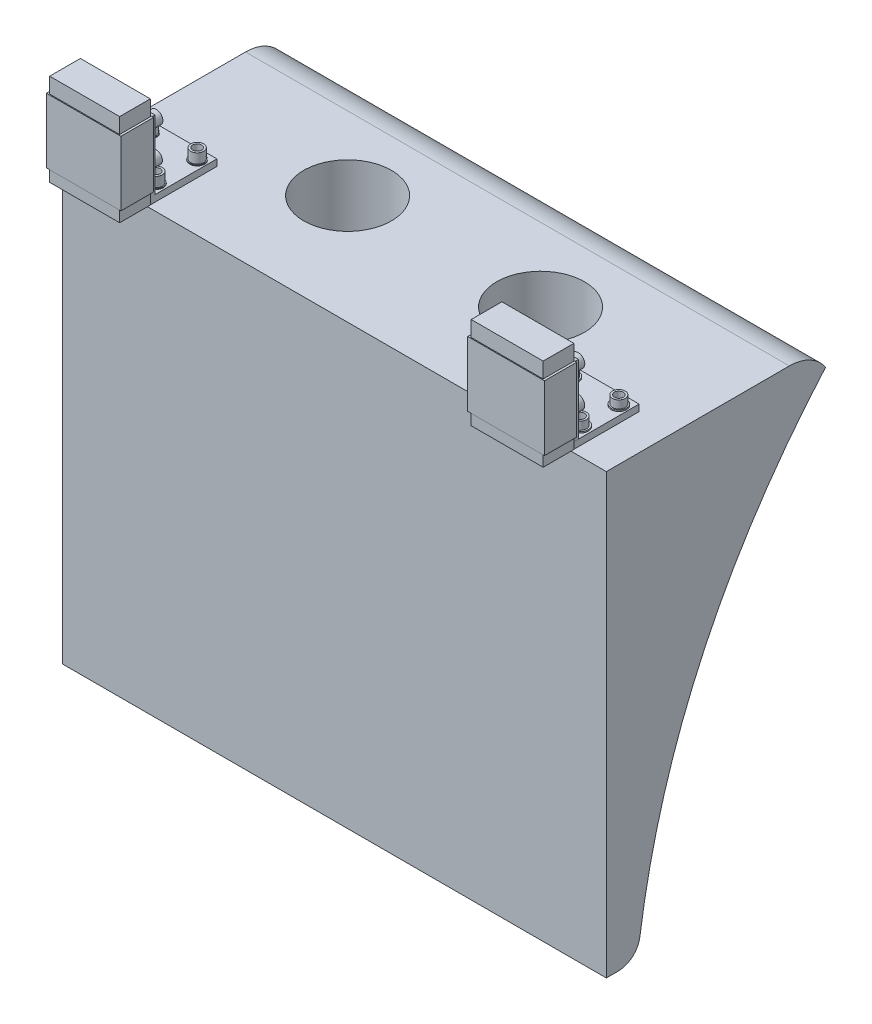
from build123d import *

# Parameters (mm, degrees)
BOSS_EXTRUDE1_DEPTH       = 242
BOSS_EXTRUDE1_DEPTH_BACK  = 6
FILLET1_R                 = 10
SKETCH2_R                 = 20
CUT_EXTRUDE2_DEPTH        = 30
SKETCH4_R                 = 20
CUT_EXTRUDE3_DEPTH        = 30
FILLET2_R                 = 20
SKETCH5_W                 = 29.954183709
SKETCH5_H                 = 31.050396145
SKETCH5_W_2               = 29.504785989
SKETCH5_H_2               = 31.799392345
BOSS_EXTRUDE2_DEPTH       = 3
SKETCH6_R                 = 3.521436552
BOSS_EXTRUDE3_DEPTH       = 0.6
SKETCH6_R_2               = 3.531766091
BOSS_EXTRUDE3_2_DEPTH     = 0.6
SKETCH6_R_3               = 3.486052036
BOSS_EXTRUDE3_3_DEPTH     = 0.6
SKETCH6_R_4               = 3.716621525
BOSS_EXTRUDE3_4_DEPTH     = 0.6
SKETCH7_R                 = 2.790281645
SKETCH7_R_2               = 1.890281645
BOSS_EXTRUDE4_DEPTH       = 3.6
SKETCH7_R_3               = 2.889128226
SKETCH7_R_4               = 1.989128226
BOSS_EXTRUDE4_2_DEPTH     = 3.6
SKETCH7_R_5               = 2.945503927
SKETCH7_R_6               = 2.045503927
BOSS_EXTRUDE4_3_DEPTH     = 3.6
SKETCH7_R_7               = 2.923587103
SKETCH7_R_8               = 2.023587103
BOSS_EXTRUDE4_4_DEPTH     = 3.6
SKETCH8_R                 = 3.59029189
SKETCH8_R_2               = 3.314555301
SKETCH8_R_3               = 3.368386703
SKETCH8_R_4               = 3.32122779
BOSS_EXTRUDE5_DEPTH       = 0.4
SKETCH9_R                 = 2.956199338
SKETCH9_R_2               = 2.056199338
SKETCH9_R_3               = 2.952787882
SKETCH9_R_4               = 2.052787882
SKETCH9_R_5               = 3.175096382
SKETCH9_R_6               = 2.275096382
SKETCH9_R_7               = 2.891369585
SKETCH9_R_8               = 1.991369585
BOSS_EXTRUDE6_DEPTH       = 4.5
SKETCH11_W                = 29.954183709
SKETCH11_H                = 3.34185216
SKETCH11_W_2              = 29.504785989
SKETCH11_H_2              = 3.531318097
BOSS_EXTRUDE7_DEPTH       = 31.5
SKETCH12_R                = 3.571562578
BOSS_EXTRUDE8_DEPTH       = 0.4
SKETCH12_R_2              = 3.629984801
BOSS_EXTRUDE8_2_DEPTH     = 0.4
SKETCH12_R_3              = 3.53819152
BOSS_EXTRUDE8_3_DEPTH     = 0.4
SKETCH12_R_4              = 3.512817256
BOSS_EXTRUDE8_4_DEPTH     = 0.4
SKETCH13_R                = 3.355416669
SKETCH13_R_2              = 3.199421294
SKETCH13_R_3              = 3.134417478
SKETCH13_R_4              = 3.44389963
BOSS_EXTRUDE9_DEPTH       = 0.4
SKETCH14_R                = 2.998694853
SKETCH14_R_2              = 2.098694853
SKETCH14_R_3              = 3.184081287
SKETCH14_R_4              = 2.284081287
SKETCH14_R_5              = 2.986646584
SKETCH14_R_6              = 2.086646584
SKETCH14_R_7              = 3.084380213
SKETCH14_R_8              = 2.184380213
SKETCH14_R_9              = 2.972177383
SKETCH14_R_10             = 2.072177383
SKETCH14_R_11             = 2.994935062
SKETCH14_R_12             = 2.094935062
SKETCH14_R_13             = 2.747519337
SKETCH14_R_14             = 1.847519337
SKETCH14_R_15             = 2.743044962
SKETCH14_R_16             = 1.843044962
BOSS_EXTRUDE10_DEPTH      = 4.5
SKETCH15_W                = 32.822125217
SKETCH15_H                = 41.949232347
SKETCH15_W_2              = 31.89694792
BOSS_EXTRUDE11_DEPTH      = 14
BOSS_EXTRUDE12_DEPTH      = 1
BOSS_EXTRUDE12_DEPTH_BACK = 33
SKETCH17_W                = 14.918298548
SKETCH17_H                = 29.467593244
BOSS_EXTRUDE13_DEPTH      = 1
BOSS_EXTRUDE13_DEPTH_BACK = 34
SKETCH18_W                = 14.661208256
SKETCH18_H                = 29.563442526


with BuildPart() as part:
    # Sketch1 → Boss-Extrude1 (new, two sides: drawn at the far end of the back side and taken through both)
    with BuildSketch(Plane(origin=(0, 0, 0), x_dir=(0, 0, -1), z_dir=(1, 0, 0)).offset(-BOSS_EXTRUDE1_DEPTH_BACK)):
        with BuildLine():
            Line((-139.187369443, 113.997653143), (-139.187369443, -86.002346857))
            Line((-139.187369443, -86.002346857), (-125.034355509, -86.002346857))
            add(Edge.make_bspline(
                [(-125.034355509, -86.002346857), (-112.066855868, 22.160578109), (-39.187369443, 105.243229852)],
                knots=[0, 0, 0, 1, 1, 1], degree=2))
            Line((-39.187369443, 105.243229852), (-39.187369443, 113.997653143))
            Line((-39.187369443, 113.997653143), (-139.187369443, 113.997653143))
        make_face()
    extrude(amount=BOSS_EXTRUDE1_DEPTH + BOSS_EXTRUDE1_DEPTH_BACK)

    # Fillet1
    fillet1_edges = [part.edges().sort_by_distance(p)[0] for p in [
        (121, -86.002346857, 125.034355509),
    ]]
    fillet(fillet1_edges, radius=FILLET1_R)

    # Sketch2 → Cut-Extrude2 (cut)
    with BuildSketch(Plane(origin=(0, 113.997653143, 0), x_dir=(1, 0, 0), z_dir=(0, 1, 0))):
        with Locations(Location((162, -89.187369443, 0), (0, 0, 270))):
            Circle(SKETCH2_R)
    extrude(amount=-CUT_EXTRUDE2_DEPTH, mode=Mode.SUBTRACT)

    # Sketch4 → Cut-Extrude3 (cut)
    with BuildSketch(Plane(origin=(0, 113.997653143, 0), x_dir=(1, 0, 0), z_dir=(0, 1, 0))):
        with Locations(Location((74, -89.187369443, 0), (0, 0, 270))):
            Circle(SKETCH4_R)
    extrude(amount=-CUT_EXTRUDE3_DEPTH, mode=Mode.SUBTRACT)

    # Fillet2
    # the kernel refuses this fillet: 20 mm, written as the material it takes off along each edge
    with BuildSketch(Plane(origin=(283.347385384, 113.997653143, 39.187369443), x_dir=(0, 0, 1), z_dir=(-1, 0, 0))) as fillet2_piece_1:
        with BuildLine():
            CenterArc((16.538954154, -20), FILLET2_R, 90, 55.786458643)
            Line((0, -8.754423292), (-0.330779083, -8.529511757))
            ThreePointArc((-0.330779083, -8.529511757), (-0.4, -4.377211646), (-0.4, 0))
            Line((-0.4, 0), (0, 0.4))
            Line((0, 0.4), (16.538954154, 0.4))
            Line((16.538954154, 0.4), (16.538954154, 0))
        make_face()
    extrude(amount=330.694770768, mode=Mode.SUBTRACT)

    # Sketch5 → Boss-Extrude2 (add)
    with BuildSketch(Plane(origin=(0, 113.997653143, 0), x_dir=(1, 0, 0), z_dir=(0, 1, 0))):
        with Locations((272.07026042, -123.560493965)):
            Rectangle(SKETCH5_W, SKETCH5_H)
        with Locations((17.934289376, -123.375461801)):
            Rectangle(SKETCH5_W_2, SKETCH5_H_2)
    extrude(amount=BOSS_EXTRUDE2_DEPTH)


with BuildPart() as boss_extrude2_piece_1:
    # of the separate pieces the step leaves, piece 1, a body of its own (boss_extrude2_pieces)
    add(part.part.solids().sort_by_distance((-6, -86.002346857, 133.804479396))[0])

    # Sketch8 → Boss-Extrude5 (add)
    with BuildSketch(Plane(origin=(0, 116.997653143, 0), x_dir=(1, 0, 0), z_dir=(0, 1, 0))):
        with Locations(Location((7.367674297, -130.775350346, 0), (0, 0, 90))):
            Circle(SKETCH8_R)
        with Locations(Location((7.104647486, -112.731711078, 0), (0, 0, 90))):
            Circle(SKETCH8_R_2)
        with Locations(Location((28.620240665, -112.416078904, 0), (0, 0, 90))):
            Circle(SKETCH8_R_3)
        with Locations(Location((28.571657152, -131.123371528, 0), (0, 0, 90))):
            Circle(SKETCH8_R_4)
    extrude(amount=BOSS_EXTRUDE5_DEPTH)

    # Sketch9 → Boss-Extrude6 (add)
    # profile 1 of 4: a face of its own
    with BuildSketch(Plane(origin=(0, 117.397653143, 0), x_dir=(1, 0, 0), z_dir=(0, 1, 0))):
        with Locations(Location((7.095441327, -112.696743219, 0), (0, 0, 270))):
            Circle(SKETCH9_R)
        with Locations(Location((7.095441327, -112.696743219, 0), (0, 0, 270))):
            Circle(SKETCH9_R_2, mode=Mode.SUBTRACT)
    # profile 2 of 4: a face of its own
    with BuildSketch(Plane(origin=(0, 117.397653143, 0), x_dir=(1, 0, 0), z_dir=(0, 1, 0))):
        with Locations(Location((28.620240665, -112.416078904, 0), (0, 0, 270))):
            Circle(SKETCH9_R_3)
        with Locations(Location((28.620240665, -112.416078904, 0), (0, 0, 270))):
            Circle(SKETCH9_R_4, mode=Mode.SUBTRACT)
    # profile 3 of 4: a face of its own
    with BuildSketch(Plane(origin=(0, 117.397653143, 0), x_dir=(1, 0, 0), z_dir=(0, 1, 0))):
        with Locations(Location((7.367674297, -130.775350346, 0), (0, 0, 270))):
            Circle(SKETCH9_R_5)
        with Locations(Location((7.367674297, -130.775350346, 0), (0, 0, 270))):
            Circle(SKETCH9_R_6, mode=Mode.SUBTRACT)
    # profile 4 of 4: a face of its own
    with BuildSketch(Plane(origin=(0, 117.397653143, 0), x_dir=(1, 0, 0), z_dir=(0, 1, 0))):
        with Locations(Location((28.571657152, -131.123371528, 0), (0, 0, 270))):
            Circle(SKETCH9_R_7)
        with Locations(Location((28.571657152, -131.123371528, 0), (0, 0, 270))):
            Circle(SKETCH9_R_8, mode=Mode.SUBTRACT)
    extrude(amount=BOSS_EXTRUDE6_DEPTH)

    # Sketch11 → Boss-Extrude7 (add)
    with BuildSketch(Plane(origin=(0, 116.997653143, 0), x_dir=(1, 0, 0), z_dir=(0, 1, 0))):
        with Locations((272.07026042, -137.414765957)):
            Rectangle(SKETCH11_W, SKETCH11_H)
        with Locations((17.934289376, -137.509498925)):
            Rectangle(SKETCH11_W_2, SKETCH11_H_2)
    extrude(amount=BOSS_EXTRUDE7_DEPTH)


with BuildPart() as boss_extrude2_piece_2:
    # of the separate pieces the step leaves, piece 2, a body of its own (boss_extrude2_pieces)
    add(part.part.solids().sort_by_distance((287.047352274, 113.997653143, 139.085692037))[0])


with BuildPart() as body_3:
    # Sketch6 → Boss-Extrude3 (new body)
    with BuildSketch(Plane(origin=(0, 116.997653143, 0), x_dir=(1, 0, 0), z_dir=(0, 1, 0))):
        with Locations(Location((261.3092488, -130.344241148, 0), (0, 0, 270))):
            Circle(SKETCH6_R)
    extrude(amount=BOSS_EXTRUDE3_DEPTH)


with BuildPart() as body_4:
    # Sketch6 → Boss-Extrude3 2 (new body)
    with BuildSketch(Plane(origin=(0, 116.997653143, 0), x_dir=(1, 0, 0), z_dir=(0, 1, 0))):
        with Locations(Location((261.004608255, -113.147316451, 0), (0, 0, 270))):
            Circle(SKETCH6_R_2)
    extrude(amount=BOSS_EXTRUDE3_2_DEPTH)


with BuildPart() as body_5:
    # Sketch6 → Boss-Extrude3 3 (new body)
    with BuildSketch(Plane(origin=(0, 116.997653143, 0), x_dir=(1, 0, 0), z_dir=(0, 1, 0))):
        with Locations(Location((282.924989398, -113.17919004, 0), (0, 0, 270))):
            Circle(SKETCH6_R_3)
    extrude(amount=BOSS_EXTRUDE3_3_DEPTH)


with BuildPart() as body_6:
    # Sketch6 → Boss-Extrude3 4 (new body)
    with BuildSketch(Plane(origin=(0, 116.997653143, 0), x_dir=(1, 0, 0), z_dir=(0, 1, 0))):
        with Locations(Location((282.476613134, -130.375500454, 0), (0, 0, 270))):
            Circle(SKETCH6_R_4)
    extrude(amount=BOSS_EXTRUDE3_4_DEPTH)


with BuildPart() as body_7:
    # Sketch7 → Boss-Extrude4 (new body)
    with BuildSketch(Plane(origin=(0, 117.597653143, 0), x_dir=(1, 0, 0), z_dir=(0, 1, 0))):
        with Locations(Location((261.3092488, -130.344241148, 0), (0, 0, 270))):
            Circle(SKETCH7_R)
        with Locations(Location((261.3092488, -130.344241148, 0), (0, 0, 270))):
            Circle(SKETCH7_R_2, mode=Mode.SUBTRACT)
    extrude(amount=BOSS_EXTRUDE4_DEPTH)


with BuildPart() as body_8:
    # Sketch7 → Boss-Extrude4 2 (new body)
    with BuildSketch(Plane(origin=(0, 117.597653143, 0), x_dir=(1, 0, 0), z_dir=(0, 1, 0))):
        with Locations(Location((261.004608255, -113.147316451, 0), (0, 0, 270))):
            Circle(SKETCH7_R_3)
        with Locations(Location((261.004608255, -113.147316451, 0), (0, 0, 270))):
            Circle(SKETCH7_R_4, mode=Mode.SUBTRACT)
    extrude(amount=BOSS_EXTRUDE4_2_DEPTH)


with BuildPart() as body_9:
    # Sketch7 → Boss-Extrude4 3 (new body)
    with BuildSketch(Plane(origin=(0, 117.597653143, 0), x_dir=(1, 0, 0), z_dir=(0, 1, 0))):
        with Locations(Location((282.476613134, -130.375500454, 0), (0, 0, 270))):
            Circle(SKETCH7_R_5)
        with Locations(Location((282.476613134, -130.375500454, 0), (0, 0, 270))):
            Circle(SKETCH7_R_6, mode=Mode.SUBTRACT)
    extrude(amount=BOSS_EXTRUDE4_3_DEPTH)


with BuildPart() as body_10:
    # Sketch7 → Boss-Extrude4 4 (new body)
    with BuildSketch(Plane(origin=(0, 117.597653143, 0), x_dir=(1, 0, 0), z_dir=(0, 1, 0))):
        with Locations(Location((282.924989398, -113.17919004, 0), (0, 0, 270))):
            Circle(SKETCH7_R_7)
        with Locations(Location((282.924989398, -113.17919004, 0), (0, 0, 270))):
            Circle(SKETCH7_R_8, mode=Mode.SUBTRACT)
    extrude(amount=BOSS_EXTRUDE4_4_DEPTH)


with BuildPart() as boss_extrude7_piece_1:
    # of the separate pieces the step leaves, piece 1, a body of its own (boss_extrude7_pieces)
    add(boss_extrude2_piece_1.part.solids().sort_by_distance((-6, -86.002346857, 133.804479396))[0])

    # Sketch13 → Boss-Extrude9 (add)
    with BuildSketch(Plane(origin=(0, 0, 135.743839877), x_dir=(-1, 0, 0), z_dir=(0, 0, -1))):
        with Locations(Location((-28.414414919, 143.13435505, 0), (0, 0, 270))):
            Circle(SKETCH13_R)
        with Locations(Location((-28.452707902, 127.335354841, 0), (0, 0, 270))):
            Circle(SKETCH13_R_2)
        with Locations(Location((-7.397497645, 127.175792958, 0), (0, 0, 270))):
            Circle(SKETCH13_R_3)
        with Locations(Location((-7.647188111, 142.931128579, 0), (0, 0, 270))):
            Circle(SKETCH13_R_4)
    extrude(amount=BOSS_EXTRUDE9_DEPTH)

    # Sketch14 → Boss-Extrude10 (add)
    # profile 1 of 8: a face of its own
    with BuildSketch(Plane(origin=(0, 0, 135.343839877), x_dir=(-1, 0, 0), z_dir=(0, 0, -1))):
        with Locations(Location((-282.078005206, 143.255450285, 0), (0, 0, 90))):
            Circle(SKETCH14_R)
        with Locations(Location((-282.078005206, 143.255450285, 0), (0, 0, 90))):
            Circle(SKETCH14_R_2, mode=Mode.SUBTRACT)
    # profile 2 of 8: a face of its own
    with BuildSketch(Plane(origin=(0, 0, 135.343839877), x_dir=(-1, 0, 0), z_dir=(0, 0, -1))):
        with Locations(Location((-261.87304946, 142.935790717, 0), (0, 0, 90))):
            Circle(SKETCH14_R_3)
        with Locations(Location((-261.87304946, 142.935790717, 0), (0, 0, 90))):
            Circle(SKETCH14_R_4, mode=Mode.SUBTRACT)
    # profile 3 of 8: a face of its own
    with BuildSketch(Plane(origin=(0, 0, 135.343839877), x_dir=(-1, 0, 0), z_dir=(0, 0, -1))):
        with Locations(Location((-261.781232047, 126.836653923, 0), (0, 0, 90))):
            Circle(SKETCH14_R_5)
        with Locations(Location((-261.781232047, 126.836653923, 0), (0, 0, 90))):
            Circle(SKETCH14_R_6, mode=Mode.SUBTRACT)
    # profile 4 of 8: a face of its own
    with BuildSketch(Plane(origin=(0, 0, 135.343839877), x_dir=(-1, 0, 0), z_dir=(0, 0, -1))):
        with Locations(Location((-281.925623501, 126.800081333, 0), (0, 0, 90))):
            Circle(SKETCH14_R_7)
        with Locations(Location((-281.925623501, 126.800081333, 0), (0, 0, 90))):
            Circle(SKETCH14_R_8, mode=Mode.SUBTRACT)
    # profile 5 of 8: a face of its own
    with BuildSketch(Plane(origin=(0, 0, 135.343839877), x_dir=(-1, 0, 0), z_dir=(0, 0, -1))):
        with Locations(Location((-28.440001176, 143.142867252, 0), (0, 0, 90))):
            Circle(SKETCH14_R_9)
        with Locations(Location((-28.440001176, 143.142867252, 0), (0, 0, 90))):
            Circle(SKETCH14_R_10, mode=Mode.SUBTRACT)
    # profile 6 of 8: a face of its own
    with BuildSketch(Plane(origin=(0, 0, 135.343839877), x_dir=(-1, 0, 0), z_dir=(0, 0, -1))):
        with Locations(Location((-7.647188111, 142.931128579, 0), (0, 0, 90))):
            Circle(SKETCH14_R_11)
        with Locations(Location((-7.647188111, 142.931128579, 0), (0, 0, 90))):
            Circle(SKETCH14_R_12, mode=Mode.SUBTRACT)
    # profile 7 of 8: a face of its own
    with BuildSketch(Plane(origin=(0, 0, 135.343839877), x_dir=(-1, 0, 0), z_dir=(0, 0, -1))):
        with Locations(Location((-28.452707902, 127.335354841, 0), (0, 0, 90))):
            Circle(SKETCH14_R_13)
        with Locations(Location((-28.452707902, 127.335354841, 0), (0, 0, 90))):
            Circle(SKETCH14_R_14, mode=Mode.SUBTRACT)
    # profile 8 of 8: a face of its own
    with BuildSketch(Plane(origin=(0, 0, 135.343839877), x_dir=(-1, 0, 0), z_dir=(0, 0, -1))):
        with Locations(Location((-7.397497645, 127.175792958, 0), (0, 0, 90))):
            Circle(SKETCH14_R_15)
        with Locations(Location((-7.397497645, 127.175792958, 0), (0, 0, 90))):
            Circle(SKETCH14_R_16, mode=Mode.SUBTRACT)
    extrude(amount=BOSS_EXTRUDE10_DEPTH)


with BuildPart() as boss_extrude7_piece_2:
    # of the separate pieces the step leaves, piece 2, a body of its own (boss_extrude7_pieces)
    add(boss_extrude2_piece_1.part.solids().sort_by_distance((287.047352274, 116.997653143, 135.743839877))[0])


with BuildPart() as body_12:
    # Sketch12 → Boss-Extrude8 (new body)
    with BuildSketch(Plane(origin=(0, 0, 135.743839877), x_dir=(-1, 0, 0), z_dir=(0, 0, -1))):
        with Locations(Location((-282.078005206, 143.255450285, 0), (0, 0, 90))):
            Circle(SKETCH12_R)
    extrude(amount=BOSS_EXTRUDE8_DEPTH)


with BuildPart() as body_13:
    # Sketch12 → Boss-Extrude8 2 (new body)
    with BuildSketch(Plane(origin=(0, 0, 135.743839877), x_dir=(-1, 0, 0), z_dir=(0, 0, -1))):
        with Locations(Location((-261.916297097, 142.918958581, 0), (0, 0, 90))):
            Circle(SKETCH12_R_2)
    extrude(amount=BOSS_EXTRUDE8_2_DEPTH)


with BuildPart() as body_14:
    # Sketch12 → Boss-Extrude8 3 (new body)
    with BuildSketch(Plane(origin=(0, 0, 135.743839877), x_dir=(-1, 0, 0), z_dir=(0, 0, -1))):
        with Locations(Location((-281.925623501, 126.800081333, 0), (0, 0, 90))):
            Circle(SKETCH12_R_3)
    extrude(amount=BOSS_EXTRUDE8_3_DEPTH)


with BuildPart() as body_15:
    # Sketch12 → Boss-Extrude8 4 (new body)
    with BuildSketch(Plane(origin=(0, 0, 135.743839877), x_dir=(-1, 0, 0), z_dir=(0, 0, -1))):
        with Locations(Location((-261.781232047, 126.836653923, 0), (0, 0, 90))):
            Circle(SKETCH12_R_4)
    extrude(amount=BOSS_EXTRUDE8_4_DEPTH)


with BuildPart() as boss_extrude10_piece_1:
    # of the separate pieces the step leaves, piece 1, a body of its own (boss_extrude10_pieces)
    add(boss_extrude7_piece_1.part.solids().sort_by_distance((-6, -86.002346857, 133.804479396))[0])

    # Sketch15 → Boss-Extrude11 (add)
    with BuildSketch(Plane.XY.offset(139.085692037)):
        with Locations((271.924973852, 136.165188854)):
            Rectangle(SKETCH15_W, SKETCH15_H)
        with Locations((17.992191051, 136.165188854)):
            Rectangle(SKETCH15_W_2, SKETCH15_H)
    extrude(amount=BOSS_EXTRUDE11_DEPTH)


with BuildPart() as boss_extrude10_piece_2:
    # of the separate pieces the step leaves, piece 2, a body of its own (boss_extrude10_pieces)
    add(boss_extrude7_piece_1.part.solids().sort_by_distance((261.87304946, 146.119872004, 135.343839877))[0])


with BuildPart() as boss_extrude10_piece_3:
    # of the separate pieces the step leaves, piece 3, a body of its own (boss_extrude10_pieces)
    add(boss_extrude7_piece_1.part.solids().sort_by_distance((281.925623501, 129.884461546, 135.343839877))[0])


with BuildPart() as boss_extrude10_piece_4:
    # of the separate pieces the step leaves, piece 4, a body of its own (boss_extrude10_pieces)
    add(boss_extrude7_piece_1.part.solids().sort_by_distance((282.078005206, 146.254145138, 135.343839877))[0])


with BuildPart() as boss_extrude10_piece_5:
    # of the separate pieces the step leaves, piece 5, a body of its own (boss_extrude10_pieces)
    add(boss_extrude7_piece_1.part.solids().sort_by_distance((261.781232047, 129.823300507, 135.343839877))[0])


with BuildPart() as boss_extrude11_piece_1:
    # of the separate pieces the step leaves, piece 1, a body of its own (boss_extrude11_pieces)
    add(boss_extrude10_piece_1.part.solids().sort_by_distance((-6, -86.002346857, 133.804479396))[0])

    # Sketch17 → Boss-Extrude12 (add, two sides: drawn at the far end of the back side and taken through both)
    with BuildSketch(Plane(origin=(33.940665011, 0, 0), x_dir=(0, 0, -1), z_dir=(1, 0, 0)).offset(-BOSS_EXTRUDE12_DEPTH_BACK)):
        with Locations((-146.038764527, 135.320459389)):
            Rectangle(SKETCH17_W, SKETCH17_H)
    extrude(amount=BOSS_EXTRUDE12_DEPTH + BOSS_EXTRUDE12_DEPTH_BACK)


with BuildPart() as boss_extrude11_piece_2:
    # of the separate pieces the step leaves, piece 2, a body of its own (boss_extrude11_pieces)
    add(boss_extrude10_piece_1.part.solids().sort_by_distance((255.513911244, 157.139805027, 139.085692037))[0])


with BuildPart() as body_21:
    # Sketch18 → Boss-Extrude13 (new, two sides: drawn at the far end of the back side and taken through both)
    with BuildSketch(Plane(origin=(288.336036461, 0, 0), x_dir=(0, 0, -1), z_dir=(1, 0, 0)).offset(-BOSS_EXTRUDE13_DEPTH_BACK)):
        with Locations((-146.167309673, 135.272534748)):
            Rectangle(SKETCH18_W, SKETCH18_H)
    extrude(amount=BOSS_EXTRUDE13_DEPTH + BOSS_EXTRUDE13_DEPTH_BACK)


with BuildPart() as body_5_1:
    # Body-Move/Copy1: moved
    add(body_5.part.moved(Location((-46.480651302, 0, 0))))


with BuildPart() as boss_extrude2_piece_2_1:
    # Body-Move/Copy1: moved
    add(boss_extrude2_piece_2.part.moved(Location((-46.480651302, 0, 0))))


with BuildPart() as body_12_1:
    # Body-Move/Copy1: moved
    add(body_12.part.moved(Location((-46.480651302, 0, 0))))


with BuildPart() as boss_extrude10_piece_4_1:
    # Body-Move/Copy1: moved
    add(boss_extrude10_piece_4.part.moved(Location((-46.480651302, 0, 0))))


with BuildPart() as boss_extrude10_piece_3_1:
    # Body-Move/Copy1: moved
    add(boss_extrude10_piece_3.part.moved(Location((-46.480651302, 0, 0))))


with BuildPart() as body_10_1:
    # Body-Move/Copy1: moved
    add(body_10.part.moved(Location((-46.480651302, 0, 0))))


with BuildPart() as body_7_1:
    # Body-Move/Copy1: moved
    add(body_7.part.moved(Location((-46.480651302, 0, 0))))


with BuildPart() as boss_extrude7_piece_2_1:
    # Body-Move/Copy1: moved
    add(boss_extrude7_piece_2.part.moved(Location((-46.480651302, 0, 0))))


with BuildPart() as body_21_1:
    # Body-Move/Copy1: moved
    add(body_21.part.moved(Location((-46.480651302, 0, 0))))


with BuildPart() as body_13_1:
    # Body-Move/Copy1: moved
    add(body_13.part.moved(Location((-46.480651302, 0, 0))))


with BuildPart() as boss_extrude10_piece_2_1:
    # Body-Move/Copy1: moved
    add(boss_extrude10_piece_2.part.moved(Location((-46.480651302, 0, 0))))


with BuildPart() as body_3_1:
    # Body-Move/Copy1: moved
    add(body_3.part.moved(Location((-46.480651302, 0, 0))))


with BuildPart() as body_14_1:
    # Body-Move/Copy1: moved
    add(body_14.part.moved(Location((-46.480651302, 0, 0))))


with BuildPart() as boss_extrude11_piece_2_1:
    # Body-Move/Copy1: moved
    add(boss_extrude11_piece_2.part.moved(Location((-46.480651302, 0, 0))))


with BuildPart() as body_15_1:
    # Body-Move/Copy2: moved
    add(body_15.part.moved(Location((-46.495329972, 0, 0))))


with BuildPart() as body_4_1:
    # Body-Move/Copy2: moved
    add(body_4.part.moved(Location((-46.495329972, 0, 0))))


with BuildPart() as body_8_1:
    # Body-Move/Copy2: moved
    add(body_8.part.moved(Location((-46.495329972, 0, 0))))


with BuildPart() as body_6_1:
    # Body-Move/Copy2: moved
    add(body_6.part.moved(Location((-46.495329972, 0, 0))))


with BuildPart() as boss_extrude10_piece_5_1:
    # Body-Move/Copy2: moved
    add(boss_extrude10_piece_5.part.moved(Location((-46.495329972, 0, 0))))


with BuildPart() as body_9_1:
    # Body-Move/Copy2: moved
    add(body_9.part.moved(Location((-46.495329972, 0, 0))))


with BuildPart() as body_9_2:
    # Body-Move/Copy3: moved
    add(body_9_1.part.moved(Location((-14.770164344, 0, 0))))


with BuildPart() as boss_extrude10_piece_2_2:
    # Body-Move/Copy3: moved
    add(boss_extrude10_piece_2_1.part.moved(Location((-14.770164344, 0, 0))))


with BuildPart() as boss_extrude10_piece_4_2:
    # Body-Move/Copy3: moved
    add(boss_extrude10_piece_4_1.part.moved(Location((-14.770164344, 0, 0))))


with BuildPart() as body_7_2:
    # Body-Move/Copy3: moved
    add(body_7_1.part.moved(Location((-14.770164344, 0, 0))))


with BuildPart() as body_5_2:
    # Body-Move/Copy3: moved
    add(body_5_1.part.moved(Location((-14.770164344, 0, 0))))


with BuildPart() as body_6_2:
    # Body-Move/Copy3: moved
    add(body_6_1.part.moved(Location((-14.770164344, 0, 0))))


with BuildPart() as body_4_2:
    # Body-Move/Copy3: moved
    add(body_4_1.part.moved(Location((-14.770164344, 0, 0))))


with BuildPart() as boss_extrude10_piece_3_2:
    # Body-Move/Copy3: moved
    add(boss_extrude10_piece_3_1.part.moved(Location((-14.770164344, 0, 0))))


with BuildPart() as body_3_2:
    # Body-Move/Copy3: moved
    add(body_3_1.part.moved(Location((-14.770164344, 0, 0))))


with BuildPart() as boss_extrude11_piece_2_2:
    # Body-Move/Copy3: moved
    add(boss_extrude11_piece_2_1.part.moved(Location((-14.770164344, 0, 0))))


with BuildPart() as boss_extrude7_piece_2_2:
    # Body-Move/Copy3: moved
    add(boss_extrude7_piece_2_1.part.moved(Location((-14.770164344, 0, 0))))


with BuildPart() as body_21_2:
    # Body-Move/Copy3: moved
    add(body_21_1.part.moved(Location((-14.770164344, 0, 0))))


with BuildPart() as body_13_2:
    # Body-Move/Copy3: moved
    add(body_13_1.part.moved(Location((-14.770164344, 0, 0))))


with BuildPart() as boss_extrude2_piece_2_2:
    # Body-Move/Copy3: moved
    add(boss_extrude2_piece_2_1.part.moved(Location((-14.770164344, 0, 0))))


with BuildPart() as body_12_2:
    # Body-Move/Copy3: moved
    add(body_12_1.part.moved(Location((-14.770164344, 0, 0))))


with BuildPart() as body_10_2:
    # Body-Move/Copy3: moved
    add(body_10_1.part.moved(Location((-14.770164344, 0, 0))))


with BuildPart() as boss_extrude10_piece_5_2:
    # Body-Move/Copy3: moved
    add(boss_extrude10_piece_5_1.part.moved(Location((-14.770164344, 0, 0))))


with BuildPart() as body_15_2:
    # Body-Move/Copy3: moved
    add(body_15_1.part.moved(Location((-14.770164344, 0, 0))))


with BuildPart() as body_8_2:
    # Body-Move/Copy3: moved
    add(body_8_1.part.moved(Location((-14.770164344, 0, 0))))


with BuildPart() as body_14_2:
    # Body-Move/Copy3: moved
    add(body_14_1.part.moved(Location((-14.770164344, 0, 0))))


solid = Compound([boss_extrude11_piece_1.part, body_9_2.part, boss_extrude10_piece_2_2.part, boss_extrude10_piece_4_2.part, body_7_2.part, body_5_2.part, body_6_2.part, body_4_2.part, boss_extrude10_piece_3_2.part, body_3_2.part, boss_extrude11_piece_2_2.part, boss_extrude7_piece_2_2.part, body_21_2.part, body_13_2.part, boss_extrude2_piece_2_2.part, body_12_2.part, body_10_2.part, boss_extrude10_piece_5_2.part, body_15_2.part, body_8_2.part, body_14_2.part])
